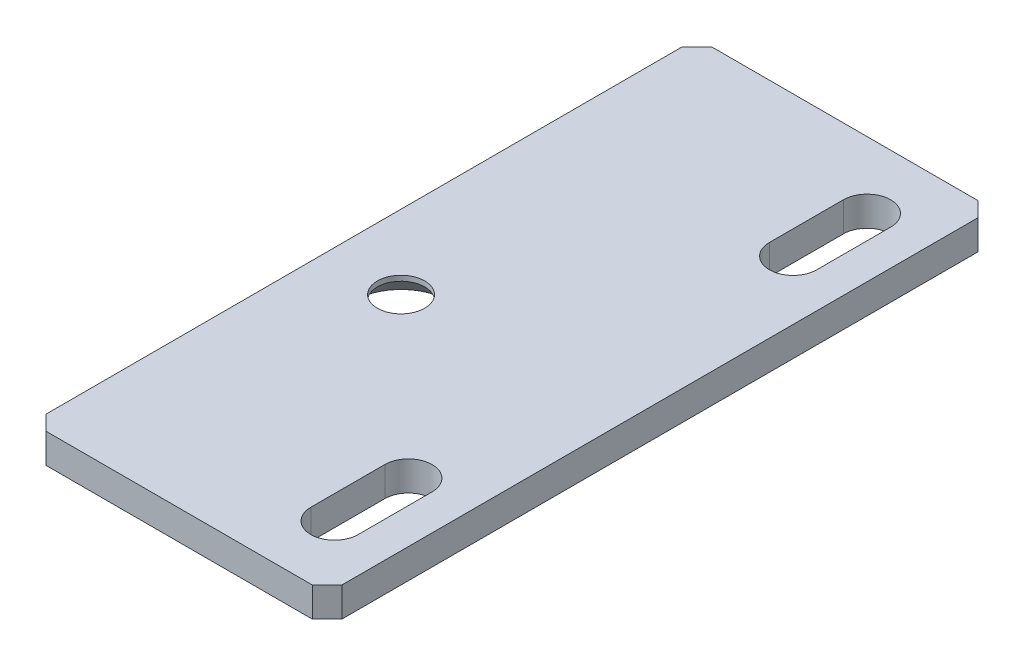
from build123d import *

# Parameters (mm, degrees)
SKETCH1_W        = 20
SKETCH1_H        = 45
BASE_DEPTH       = 2
SCREWSLOTS_DEPTH = 25.703238654
CHAMFER1_SIZE    = 1


with BuildPart() as part:
    # Sketch1 → Base (new body)
    with BuildSketch(Plane(origin=(0, 0, 0), x_dir=(1, 0, 0), z_dir=(0, 1, 0))):
        Rectangle(SKETCH1_W, SKETCH1_H)
    extrude(amount=BASE_DEPTH)

    # Sketch6 → ScrewSlots (cut, through all)
    with BuildSketch(Plane(origin=(0, 2, 0), x_dir=(1, 0, 0), z_dir=(0, 1, 0))):
        with BuildLine():
            Line((7.6, 18), (7.6, 13))
            ThreePointArc((7.6, 13), (6, 11.4), (4.4, 13))
            Line((4.4, 13), (4.4, 18))
            ThreePointArc((4.4, 18), (6, 19.6), (7.6, 18))
        make_face()
        with BuildLine():
            Line((7.6, -13), (7.6, -18))
            ThreePointArc((7.6, -18), (6, -19.6), (4.4, -18))
            Line((4.4, -18), (4.4, -13))
            ThreePointArc((4.4, -13), (6, -11.4), (7.6, -13))
        make_face()
    extrude(amount=-SCREWSLOTS_DEPTH, mode=Mode.SUBTRACT)

    # Sketch5 → PulleyHole (revolve, cut)
    with BuildSketch(Plane(origin=(-5, 0, 2.5), x_dir=(0, 0, -1), z_dir=(1, 0, 0))):
        Polygon((0, 0), (0, 2), (1.6, 2), (1.6, 1.65), (3.25, 0), align=None)
    revolve(axis=Axis((-5, -6.35, 2.5), (0, 1, 0)), mode=Mode.SUBTRACT)

    # Chamfer1
    chamfer1_edges = [part.edges().sort_by_distance(p)[0] for p in [
        (-10, 1, -22.5),
        (10, 1, -22.5),
        (10, 1, 22.5),
        (-10, 1, 22.5),
    ]]
    chamfer(chamfer1_edges, length=CHAMFER1_SIZE)


solid = part.part
